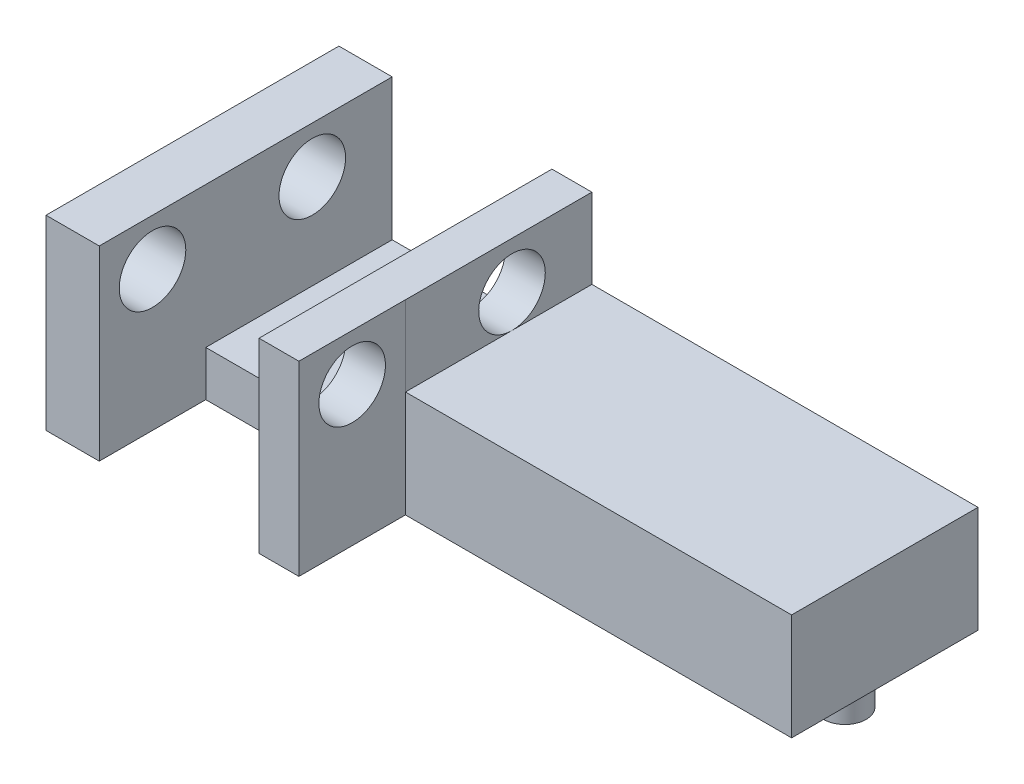
from build123d import *

# Parameters (mm, degrees)
SKETCH1_R             = 0.8
BOSS_EXTRUDE1_DEPTH   = 3
BOSS_EXTRUDE1_2_DEPTH = 3
BOSS_EXTRUDE1_3_DEPTH = 3
SKETCH1_R_2           = 1.2
BOSS_EXTRUDE1_4_DEPTH = 3
SKETCH3_W             = 24
SKETCH3_H             = 4
BOSS_EXTRUDE2_DEPTH   = 4
SKETCH6_W             = 24
SKETCH6_H             = 4
BOSS_EXTRUDE4_DEPTH   = 3
CUT_EXTRUDE1_DEPTH    = 2.3
SKETCH9_W             = 2
SKETCH9_H             = 7
SKETCH9_W_2           = 1.5
BOSS_EXTRUDE5_DEPTH   = 3
SKETCH11_W            = 2
SKETCH11_H            = 7
SKETCH11_W_2          = 1.497470588
BOSS_EXTRUDE6_DEPTH   = 4
SKETCH10_R            = 1.25
CUT_EXTRUDE2_DEPTH    = 18.557049866


with BuildPart() as part:
    # Sketch1 → Boss-Extrude1 (new body)
    with BuildSketch(Plane(origin=(0, 0, 0), x_dir=(1, 0, 0), z_dir=(0, 1, 0))):
        with Locations((-23, 2)):
            Circle(SKETCH1_R)
    extrude(amount=-BOSS_EXTRUDE1_DEPTH)



with BuildPart() as body_2:
    # Sketch1 → Boss-Extrude1 2 (new body)
    with BuildSketch(Plane(origin=(0, 0, 0), x_dir=(1, 0, 0), z_dir=(0, 1, 0))):
        with Locations((-4, 2)):
            Circle(SKETCH1_R)
    extrude(amount=-BOSS_EXTRUDE1_2_DEPTH)


with BuildPart() as body_3:
    # Sketch1 → Boss-Extrude1 3 (new body)
    with BuildSketch(Plane(origin=(0, 0, 0), x_dir=(1, 0, 0), z_dir=(0, 1, 0))):
        with Locations((-14, 2)):
            Circle(SKETCH1_R)
    extrude(amount=-BOSS_EXTRUDE1_3_DEPTH)


with BuildPart() as body_4:
    # Sketch1 → Boss-Extrude1 4 (new body)
    with BuildSketch(Plane(origin=(0, 0, 0), x_dir=(1, 0, 0), z_dir=(0, 1, 0))):
        with Locations((-18.5, 2)):
            Circle(SKETCH1_R_2)
    extrude(amount=-BOSS_EXTRUDE1_4_DEPTH)


with BuildPart() as part_1:
    add(part.part)

    add(body_2.part)  # Boss-Extrude2 merges body 2

    add(body_3.part)  # Boss-Extrude2 merges body 3

    add(body_4.part)  # Boss-Extrude2 merges body 4
    # Sketch3 → Boss-Extrude2 (add)
    with BuildSketch(Plane(origin=(0, 0, 0), x_dir=(1, 0, 0), z_dir=(0, 1, 0))):
        with Locations((-13, 2)):
            Rectangle(SKETCH3_W, SKETCH3_H)
    extrude(amount=BOSS_EXTRUDE2_DEPTH)

    # Sketch6 → Boss-Extrude4 (add)
    with BuildSketch(Plane.XY):
        with Locations((-13, 2)):
            Rectangle(SKETCH6_W, SKETCH6_H)
    extrude(amount=BOSS_EXTRUDE4_DEPTH)

    # Sketch7 → Cut-Extrude1 (cut)
    with BuildSketch(Plane(origin=(0, 4, 0), x_dir=(1, 0, 0), z_dir=(0, 1, 0))):
        Polygon((-23, 0.5), (-23, -3), (-17, -3), (-17, 4), (-23, 4), align=None)
    extrude(amount=-CUT_EXTRUDE1_DEPTH, mode=Mode.SUBTRACT)

    # Sketch9 → Boss-Extrude5 (add)
    with BuildSketch(Plane(origin=(0, 4, 0), x_dir=(1, 0, 0), z_dir=(0, 1, 0))):
        with Locations((-24, 0.5)):
            Rectangle(SKETCH9_W, SKETCH9_H)
        with Locations((-16.25, 0.5)):
            Rectangle(SKETCH9_W_2, SKETCH9_H)
    extrude(amount=BOSS_EXTRUDE5_DEPTH)

    # Sketch11 → Boss-Extrude6 (add)
    with BuildSketch(Plane.XY.offset(3)):
        with Locations((-24, 3.5)):
            Rectangle(SKETCH11_W, SKETCH11_H)
        with Locations((-16.251264706, 3.5)):
            Rectangle(SKETCH11_W_2, SKETCH11_H)
    extrude(amount=BOSS_EXTRUDE6_DEPTH)

    # Sketch10 → Cut-Extrude2 (cut, through all)
    with BuildSketch(Plane(origin=(-15.5, 0, 0), x_dir=(0, 0, -1), z_dir=(1, 0, 0))):
        with Locations((1, 5.25)):
            Circle(SKETCH10_R)
        with Locations((-5, 5.25)):
            Circle(SKETCH10_R)
    extrude(amount=-CUT_EXTRUDE2_DEPTH, mode=Mode.SUBTRACT)


solid = part_1.part
